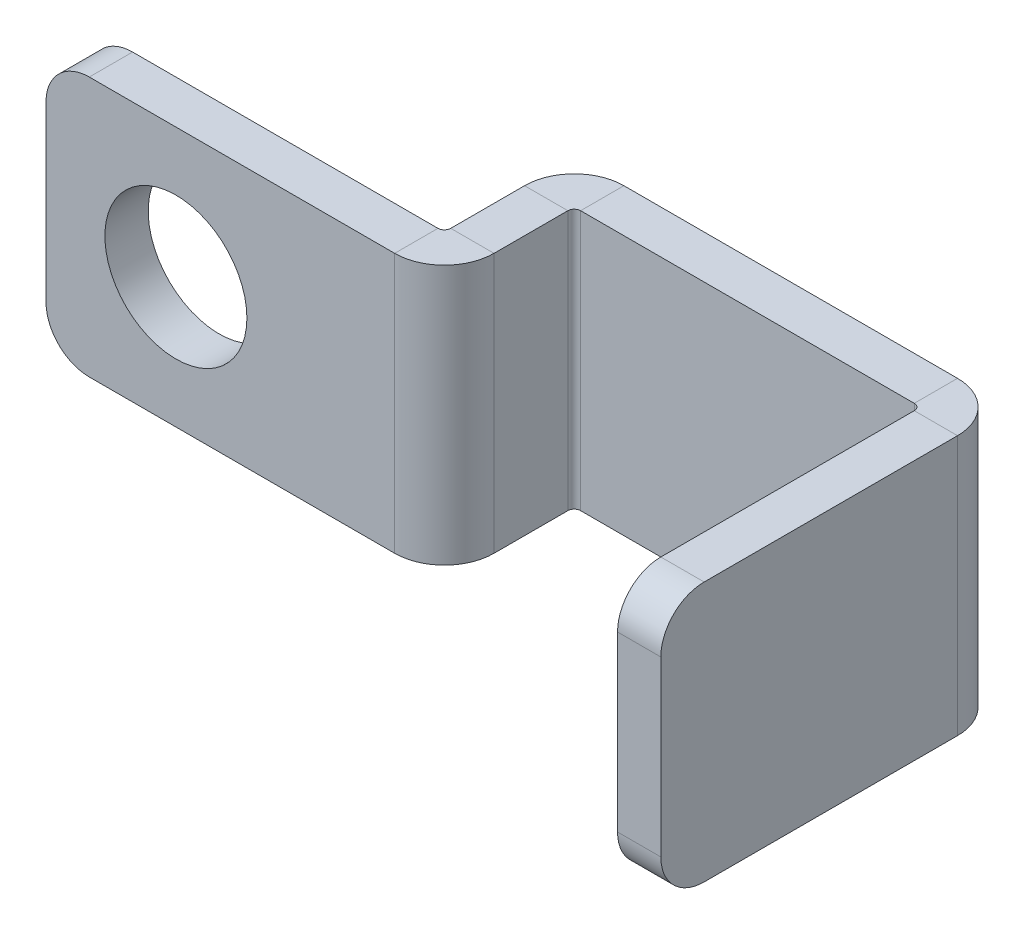
from build123d import *

# Parameters (mm, degrees)
SZKIC1_W                           = 46
SZKIC1_H                           = 30
SZKIC1_R                           = 8.2
ODGI_CIE_BAZOWE1_DEPTH             = 5
ODGI_CIE_KRAW_DZI1_STRIP_W         = 21.4732
ODGI_CIE_KRAW_DZI1_STRIP_H         = 5
ODGI_CIE_KRAW_DZI1_STRIP_CUT_DEPTH = 30
ODGI_CIE_KRAW_DZI1_DEPTH           = 30
ODGI_CIE_KRAW_DZI2_STRIP_W         = 21.4732
ODGI_CIE_KRAW_DZI2_STRIP_H         = 5
ODGI_CIE_KRAW_DZI2_STRIP_CUT_DEPTH = 30
ODGI_CIE_KRAW_DZI2_DEPTH           = 30
ODGI_CIE_KRAW_DZI3_STRIP_W         = 21.4732
ODGI_CIE_KRAW_DZI3_STRIP_H         = 5
ODGI_CIE_KRAW_DZI3_STRIP_CUT_DEPTH = 30
ODGI_CIE_KRAW_DZI3_DEPTH           = 30
OD_AM_START                        = 63
OD_AM_NARO_NIK1_DEPTH              = 5
OD_AM_START_2                      = -5
OD_AM_NARO_NIK1_2_DEPTH            = 5


# Read off the part's stored shape, not the designer's step: Odłam narożnik1
# Sheet-metal steps are written as plain solids
with BuildPart() as part:
    # Szkic1 → Odgięcie bazowe1 (new body)
    with BuildSketch(Plane.XY):
        Rectangle(SZKIC1_W, SZKIC1_H)
        with Locations((-8, 0)):
            Circle(SZKIC1_R, mode=Mode.SUBTRACT)
    extrude(amount=-ODGI_CIE_BAZOWE1_DEPTH)

    # Odgięcie krawędzi1 strip (across the edge) → Odgięcie krawędzi1 strip cut (cut)
    with BuildSketch(Plane(origin=(23, 15, -5), x_dir=(-1, 0, 0), z_dir=(0, -1, 0))):
        with Locations((-5, -2.5)):
            Rectangle(ODGI_CIE_KRAW_DZI1_STRIP_W, ODGI_CIE_KRAW_DZI1_STRIP_H)
    extrude(amount=ODGI_CIE_KRAW_DZI1_STRIP_CUT_DEPTH, mode=Mode.SUBTRACT)

    # Odgięcie krawędzi1 section (across the edge) → Odgięcie krawędzi1 (add)
    with BuildSketch(Plane(origin=(23, 15, -5), x_dir=(-1, 0, 0), z_dir=(0, -1, 0))):
        with BuildLine():
            Line((0, 0.7366), (0, 15))
            Line((0, 15), (5, 15))
            Line((5, 15), (5, 0.7366))
            ThreePointArc((5, 0.7366), (5.215745145, 0.215745145), (5.7366, 0))
            Line((5.7366, 0), (5.7366, -5))
            ThreePointArc((5.7366, -5), (1.680211239, -3.319788761), (0, 0.7366))
        make_face()
    extrude(amount=ODGI_CIE_KRAW_DZI1_DEPTH)

    # Odgięcie krawędzi2 strip (across the edge) → Odgięcie krawędzi2 strip cut (cut)
    with BuildSketch(Plane(origin=(23, -15, -20), x_dir=(0, 0, 1), z_dir=(0, 1, 0))):
        with Locations((-5, -2.5)):
            Rectangle(ODGI_CIE_KRAW_DZI2_STRIP_W, ODGI_CIE_KRAW_DZI2_STRIP_H)
    extrude(amount=ODGI_CIE_KRAW_DZI2_STRIP_CUT_DEPTH, mode=Mode.SUBTRACT)

    # Odgięcie krawędzi2 section (across the edge) → Odgięcie krawędzi2 (add)
    with BuildSketch(Plane(origin=(23, -15, -20), x_dir=(0, 0, 1), z_dir=(0, 1, 0))):
        with BuildLine():
            Line((0, 0.7366), (0, 45))
            Line((0, 45), (5, 45))
            Line((5, 45), (5, 0.7366))
            ThreePointArc((5, 0.7366), (5.215745145, 0.215745145), (5.7366, 0))
            Line((5.7366, 0), (5.7366, -5))
            ThreePointArc((5.7366, -5), (1.680211239, -3.319788761), (0, 0.7366))
        make_face()
    extrude(amount=ODGI_CIE_KRAW_DZI2_DEPTH)

    # Odgięcie krawędzi3 strip (across the edge) → Odgięcie krawędzi3 strip cut (cut)
    with BuildSketch(Plane(origin=(68, -15, -15), x_dir=(-1, 0, 0), z_dir=(0, 1, 0))):
        with Locations((-5, -2.5)):
            Rectangle(ODGI_CIE_KRAW_DZI3_STRIP_W, ODGI_CIE_KRAW_DZI3_STRIP_H)
    extrude(amount=ODGI_CIE_KRAW_DZI3_STRIP_CUT_DEPTH, mode=Mode.SUBTRACT)

    # Odgięcie krawędzi3 section (across the edge) → Odgięcie krawędzi3 (add)
    with BuildSketch(Plane(origin=(68, -15, -15), x_dir=(-1, 0, 0), z_dir=(0, 1, 0))):
        with BuildLine():
            Line((0, 0.7366), (0, 35))
            Line((0, 35), (5, 35))
            Line((5, 35), (5, 0.7366))
            ThreePointArc((5, 0.7366), (5.215745145, 0.215745145), (5.7366, 0))
            Line((5.7366, 0), (5.7366, -5))
            ThreePointArc((5.7366, -5), (1.680211239, -3.319788761), (0, 0.7366))
        make_face()
    extrude(amount=ODGI_CIE_KRAW_DZI3_DEPTH)

    # Odłam narożnik1 outline → Odłam narożnik1 (cut)
    with BuildSketch(Plane.YZ.offset(OD_AM_START)):
        with BuildLine():
            Line((-15, 20), (-15, 15))
            ThreePointArc((-15, 15), (-13.535533906, 18.535533906), (-10, 20))
            Line((-10, 20), (-15, 20))
        make_face()
        with BuildLine():
            Line((15, 20), (10, 20))
            ThreePointArc((10, 20), (13.535533906, 18.535533906), (15, 15))
            Line((15, 15), (15, 20))
        make_face()
    extrude(amount=OD_AM_NARO_NIK1_DEPTH, mode=Mode.SUBTRACT)

    # Od_am naro_nik1 2 outline → Od_am naro_nik1 2 (cut)
    with BuildSketch(Plane.XY.offset(OD_AM_START_2)):
        with BuildLine():
            ThreePointArc((-18, -15), (-21.535533906, -13.535533906), (-23, -10))
            Line((-23, -10), (-23, -15))
            Line((-23, -15), (-18, -15))
        make_face()
        with BuildLine():
            ThreePointArc((-23, 10), (-21.535533906, 13.535533906), (-18, 15))
            Line((-18, 15), (-23, 15))
            Line((-23, 15), (-23, 10))
        make_face()
    extrude(amount=OD_AM_NARO_NIK1_2_DEPTH, mode=Mode.SUBTRACT)


solid = part.part
